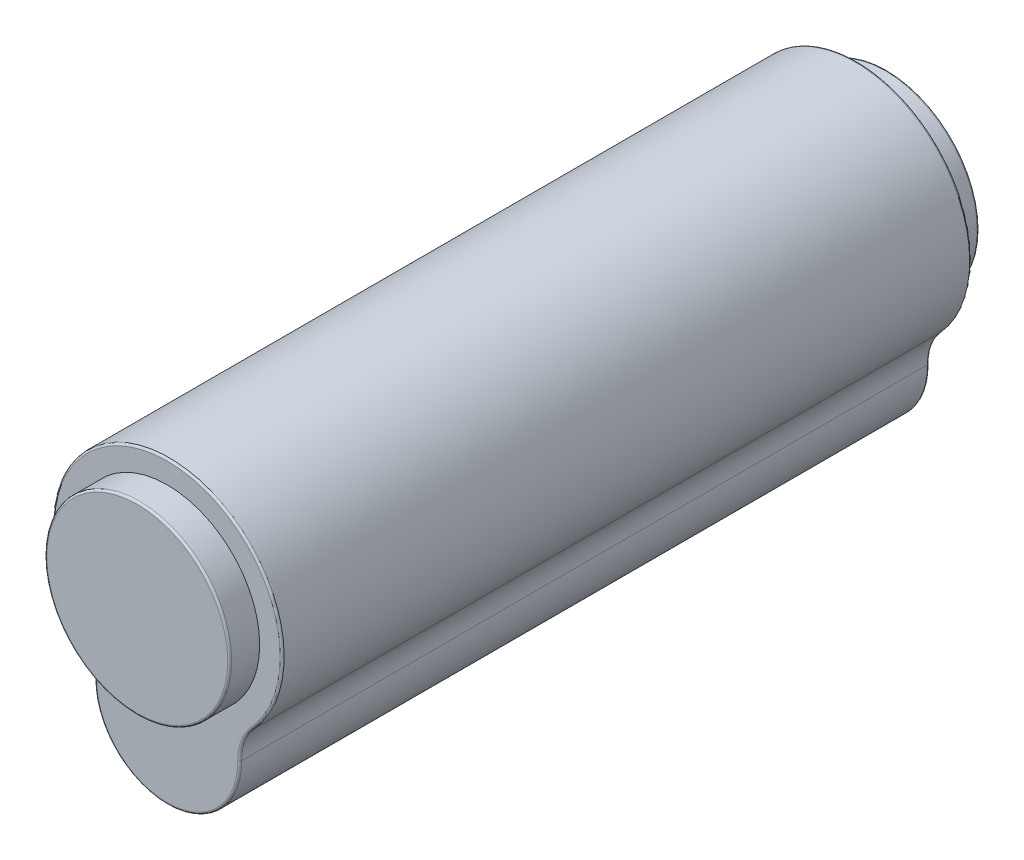
from build123d import *

# Parameters (mm, degrees)
EXTRUSION1_DEPTH   = 69
ESQUISSE2_R        = 9.25
BOSS_EXTRU_1_DEPTH = 3
BOSS_EXTRU_2_START = 3
ESQUISSE3_R        = 9.25
BOSS_EXTRU_2_DEPTH = 3
CONG_1_R           = 0.2
COQUE2_START       = 1
COQUE2_DEPTH       = 67
COQUE2_START_2     = -2
COQUE2_2_OUTLINE_R = 8.25
COQUE2_2_DEPTH     = 73


# Read off the part's stored shape, not the designer's step: Coque2
with BuildPart() as part:
    # Esquisse1 → Extrusion1 (new body)
    with BuildSketch(Plane.XY):
        with BuildLine():
            ThreePointArc((-8.53680315, -7.705387205), (-7.567547804, -9.297974269), (-7.249086614, -11.134920635))
            ThreePointArc((-7.249086614, -11.134920635), (0, -18.5), (7.249086614, -11.134920635))
            ThreePointArc((7.249086614, -11.134920635), (7.567547804, -9.297974269), (8.53680315, -7.705387205))
            ThreePointArc((8.53680315, -7.705387205), (0, 11.5), (-8.53680315, -7.705387205))
        make_face()
    extrude(amount=EXTRUSION1_DEPTH)

    # Esquisse2 → Boss.-Extru.1 (add)
    with BuildSketch(Plane.XY.offset(69)):
        Circle(ESQUISSE2_R)
    extrude(amount=BOSS_EXTRU_1_DEPTH)

    # Esquisse3 → Boss.-Extru.2 (add)
    with BuildSketch(Plane(origin=(0, 0, 0), x_dir=(-1, 0, 0), z_dir=(0, 0, -1)).offset(BOSS_EXTRU_2_START)):
        with Locations(Location((0, 0, 0), (0, 0, 180))):
            Circle(ESQUISSE3_R)
    extrude(amount=-BOSS_EXTRU_2_DEPTH)

    # Congé1
    cong_1_edges = [part.edges().sort_by_distance(p)[0] for p in [
        (0, -18.5, 69),
        (7.567547804, -9.297974269, 69),
        (-9.25, 0, 72),
        (-9.25, 0, -3),
        (0, 11.5, 69),
        (7.567547804, -9.297974269, 0),
        (0, -18.5, 0),
        (-7.567547804, -9.297974269, 0),
        (0, 11.5, 0),
        (-7.567547804, -9.297974269, 69),
    ]]
    fillet(cong_1_edges, radius=CONG_1_R)

    # Coque2 outline → Coque2 (cut)
    with BuildSketch(Plane.XY.offset(COQUE2_START)):
        with BuildLine():
            ThreePointArc((7.794472441, -7.035353535), (0, 10.5), (-7.794472441, -7.035353535))
            ThreePointArc((-7.794472441, -7.035353535), (-6.631366027, -8.946458012), (-6.249212598, -11.150793651))
            ThreePointArc((-6.249212598, -11.150793651), (0, -17.5), (6.249212598, -11.150793651))
            ThreePointArc((6.249212598, -11.150793651), (6.631366027, -8.946458012), (7.794472441, -7.035353535))
        make_face()
    extrude(amount=COQUE2_DEPTH, mode=Mode.SUBTRACT)

    # Coque2 2 outline → Coque2 2 (cut)
    with BuildSketch(Plane.XY.offset(COQUE2_START_2)):
        Circle(COQUE2_2_OUTLINE_R)
    extrude(amount=COQUE2_2_DEPTH, mode=Mode.SUBTRACT)


solid = part.part
